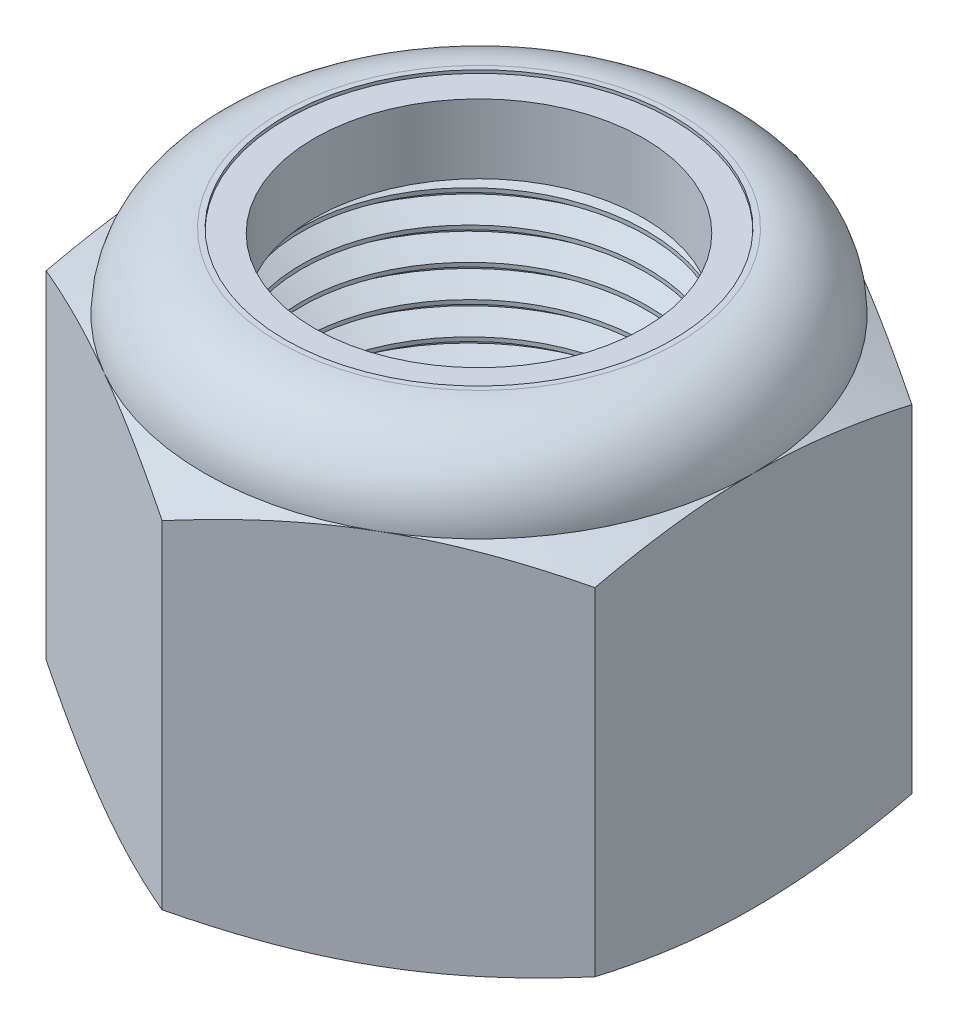
from build123d import *

# Parameters (mm, degrees)
SKETCH1_R        = 9.525
EXTRUDE1_DEPTH   = 22.225
SKETCH2_W        = 9.525
SKETCH2_H        = 18.520833333
CUT_SWEEP1_PITCH = 1.5875
SKETCH12_W       = 10.4775
SKETCH12_H       = 18.520833333


with BuildPart() as part:
    # Sketch1 → Extrude1 (new body)
    with BuildSketch(Plane(origin=(0, 0, 0), x_dir=(1, 0, 0), z_dir=(0, 1, 0))):
        Polygon((0, 15.58124039), (-13.49375, 7.790620195), (-13.49375, -7.790620195), (0, -15.58124039), (13.49375, -7.790620195), (13.49375, 7.790620195), align=None)
        with Locations(Location((0, 0, 0), (0, 0, 270))):
            Circle(SKETCH1_R, mode=Mode.SUBTRACT)
    extrude(amount=EXTRUDE1_DEPTH)

    # Sketch5 → Cut-Revolve3 (revolve, cut)
    with BuildSketch(Plane(origin=(0, 0, 0), x_dir=(0, 0, -1), z_dir=(1, 0, 0))):
        with BuildLine():
            Line((0, 0), (13.49375, 0))
            Line((13.49375, 0), (15.58124039, 0.973412755))
            Line((15.58124039, 0.973412755), (15.58124039, 17.547420578))
            Line((15.58124039, 17.547420578), (13.49375, 18.520833333))
            ThreePointArc((13.49375, 18.520833333), (12.408824702, 21.140074702), (9.789583333, 22.225))
            Line((9.789583333, 22.225), (9.789583333, 23.495))
            Line((9.789583333, 23.495), (16.85124039, 23.495))
            Line((16.85124039, 23.495), (16.85124039, -1.27))
            Line((16.85124039, -1.27), (0, -1.27))
            Line((0, -1.27), (0, 0))
        make_face()
    revolve(axis=Axis((0, 0, 0), (0, 1, 0)), mode=Mode.SUBTRACT)

    # Sketch6 → Cut-Revolve4 (revolve, cut)
    with BuildSketch(Plane(origin=(0, 0, 0), x_dir=(0, 0, -1), z_dir=(1, 0, 0)), mode=Mode.PRIVATE) as cut_revolve4_sk:
        with BuildLine():
            Line((0, 18.520833333), (13.34135, 18.520833333))
            ThreePointArc((13.34135, 18.520833333), (12.301061629, 21.032311629), (9.789583333, 22.0726))
            Line((9.789583333, 22.0726), (4.894791667, 22.0726))
            Line((4.894791667, 22.0726), (4.894791667, 23.495))
            Line((4.894791667, 23.495), (0, 23.495))
            Line((0, 23.495), (0, 18.520833333))
        make_face()
    revolve(cut_revolve4_sk.sketch.rotate(Axis((0, 23.495, 0), (0, -1, 0)), 180), axis=Axis((0, 23.495, 0), (0, -1, 0)), mode=Mode.SUBTRACT)

    # Sketch4 → Cut-Revolve2 (revolve, cut)
    with BuildSketch(Plane(origin=(0, 0, 0), x_dir=(0, 0, -1), z_dir=(1, 0, 0))):
        Polygon((0, 18.520833333), (10.4775, 18.520833333), (0, 13.635094845), align=None)
        Polygon((0, 4.885738488), (10.4775, 0), (0, 0), align=None)
    revolve(axis=Axis((0, 0, 0), (0, 1, 0)), mode=Mode.SUBTRACT)

    # Sketch12 → Revolve4 (revolve)
    with BuildSketch(Plane(origin=(0, 0, 0), x_dir=(0, 0, -1), z_dir=(1, 0, 0)), mode=Mode.PRIVATE) as revolve4_sk:
        with Locations((5.23875, 9.260416667)):
            Rectangle(SKETCH12_W, SKETCH12_H)
    revolve(revolve4_sk.sketch.rotate(Axis((0, 0, 0), (0, 1, 0)), 265.555028904), axis=Axis((0, 0, 0), (0, 1, 0)))


with BuildPart() as body_2:
    # Sketch7 → Revolve2 (revolve)
    with BuildSketch(Plane(origin=(0, 0, 0), x_dir=(0, 0, -1), z_dir=(1, 0, 0))):
        with BuildLine():
            Line((8.09625, 18.597033333), (13.264314577, 18.597033333))
            ThreePointArc((13.264314577, 18.597033333), (12.220090017, 21.005224791), (9.789583333, 21.9964))
            Line((9.789583333, 21.9964), (8.09625, 21.9964))
            Line((8.09625, 21.9964), (8.09625, 18.597033333))
        make_face()
    revolve(axis=Axis((0, 18.597033333, 0), (0, 1, 0)))


with BuildPart() as body_3:
    # Sketch2 → Revolve1 (revolve)
    with BuildSketch(Plane(origin=(0, 0, 0), x_dir=(0, 0, -1), z_dir=(1, 0, 0))):
        with Locations((4.7625, 9.260416667)):
            Rectangle(SKETCH2_W, SKETCH2_H)
    revolve(axis=Axis((0, -9.525, 0), (0, 1, 0)))

    # Cut-Sweep1: the profile of Sketch9 screwed along a right-hand helix of 15 turns, 8 arcs to a turn; built about Z, then put on its axis
    cut_sweep1_z = Axis((0, 0, 0), (0, 0, 1))
    cut_sweep1_corners = [(9.696851916, 0, 0.09921875), (9.610925958, 0, -1.438671875), (8.493888504, 0, -0.79375), (8.493888504, 0, -0.5953125)]
    with BuildLine(mode=Mode.PRIVATE) as cut_sweep1_profile:
        Line(cut_sweep1_corners[0], cut_sweep1_corners[1])
        Line(cut_sweep1_corners[1], cut_sweep1_corners[2])
        Line(cut_sweep1_corners[2], cut_sweep1_corners[3])
        Line(cut_sweep1_corners[3], cut_sweep1_corners[0])
    cut_sweep1_cap = Face(cut_sweep1_profile.wire())
    cut_sweep1_turn_angles = [0, 22.5, 45, 67.5, 90, 112.5, 135, 157.5, 180, 202.5, 225, 247.5, 270, 292.5, 315, 337.5, 360]
    cut_sweep1_turn_weights = [1, 0.9238795325112867, 1, 0.9238795325112867, 1, 0.9238795325112867, 1, 0.9238795325112867, 1, 0.9238795325112867, 1, 0.9238795325112867, 1, 0.9238795325112867, 1, 0.9238795325112867, 1]
    cut_sweep1_turn_rails = [Edge.make_bspline([Vector(p[0], p[1], 0).rotate(cut_sweep1_z, cut_sweep1_turn_angles[k]) / cut_sweep1_turn_weights[k] + Vector(0, 0, p[2] + CUT_SWEEP1_PITCH * cut_sweep1_turn_angles[k] / 360) for k in range(17)], [0, 0, 0, 1, 1, 2, 2, 3, 3, 4, 4, 5, 5, 6, 6, 7, 7, 8, 8, 8], 2, cut_sweep1_turn_weights) for p in cut_sweep1_corners]
    cut_sweep1_turn_sides = [Face.make_surface_from_curves(cut_sweep1_turn_rails[p[0]], cut_sweep1_turn_rails[p[1]]) for p in [(0, 1), (1, 2), (2, 3), (3, 0)]]
    cut_sweep1 = Plane(origin=(0, 18.520833333, 0), x_dir=(0, 0, -1), z_dir=(0, -1, 0)) * Solid(Shell([*[p.moved(Location((0, 0, CUT_SWEEP1_PITCH * i))) for i in range(15) for p in cut_sweep1_turn_sides], cut_sweep1_cap, cut_sweep1_cap.rotate(cut_sweep1_z, 5400).moved(Location((0, 0, CUT_SWEEP1_PITCH * 5400 / 360)))]))
    add(cut_sweep1, mode=Mode.SUBTRACT)

    # Sketch11 → Revolve3 (revolve)
    with BuildSketch(Plane(origin=(0, 0, 0), x_dir=(0, 0, -1), z_dir=(1, 0, 0))):
        Polygon((0, 0), (10.4775, 0), (0, 4.885738488), align=None)
    revolve(axis=Axis((0, 22.225, 0), (0, -1, 0)))


with BuildPart() as part_1:
    add(part.part)

    # Combine1: cut body 3
    add(body_3.part, mode=Mode.SUBTRACT)


solid = Compound([body_2.part, part_1.part])
